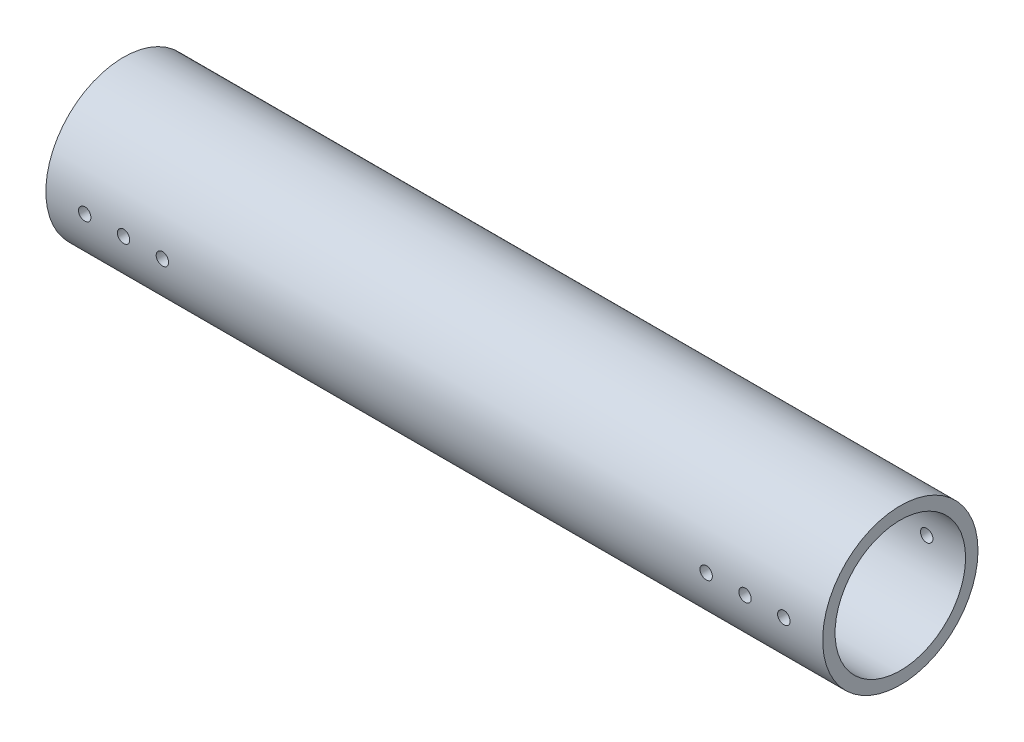
from build123d import *

# Parameters (mm, degrees)
SKETCH_2_R               = 25
SKETCH_2_R_2             = 21
EXTRUDE_2_DEPTH          = 250
CUT_EXTRUDE_2_DEPTH      = 10
CUT_EXTRUDE_2_DEPTH_BACK = 257.173769149
SKETCH_4_R               = 2


with BuildPart() as part:
    # Эскиз2 → Бобышка-Вытянуть2 (new body)
    with BuildSketch(Plane(origin=(0, 0, 0), x_dir=(0, 0, -1), z_dir=(1, 0, 0))):
        Circle(SKETCH_2_R)
        Circle(SKETCH_2_R_2, mode=Mode.SUBTRACT)
    extrude(amount=EXTRUDE_2_DEPTH)

    # Эскиз4 → Вырез-Вытянуть2 (cut, two sides: drawn at the far end of the back side and taken through both)
    with BuildSketch(Plane.XY.offset(25).offset(-CUT_EXTRUDE_2_DEPTH_BACK)):
        with Locations((12.5, 0)):
            Circle(SKETCH_4_R)
        with Locations((237.5, 0)):
            Circle(SKETCH_4_R)
        with Locations((25, 0)):
            Circle(SKETCH_4_R)
        with Locations((37.5, 0)):
            Circle(SKETCH_4_R)
        with Locations((225, 0)):
            Circle(SKETCH_4_R)
        with Locations((212.5, 0)):
            Circle(SKETCH_4_R)
    extrude(amount=CUT_EXTRUDE_2_DEPTH + CUT_EXTRUDE_2_DEPTH_BACK, mode=Mode.SUBTRACT)


solid = part.part
